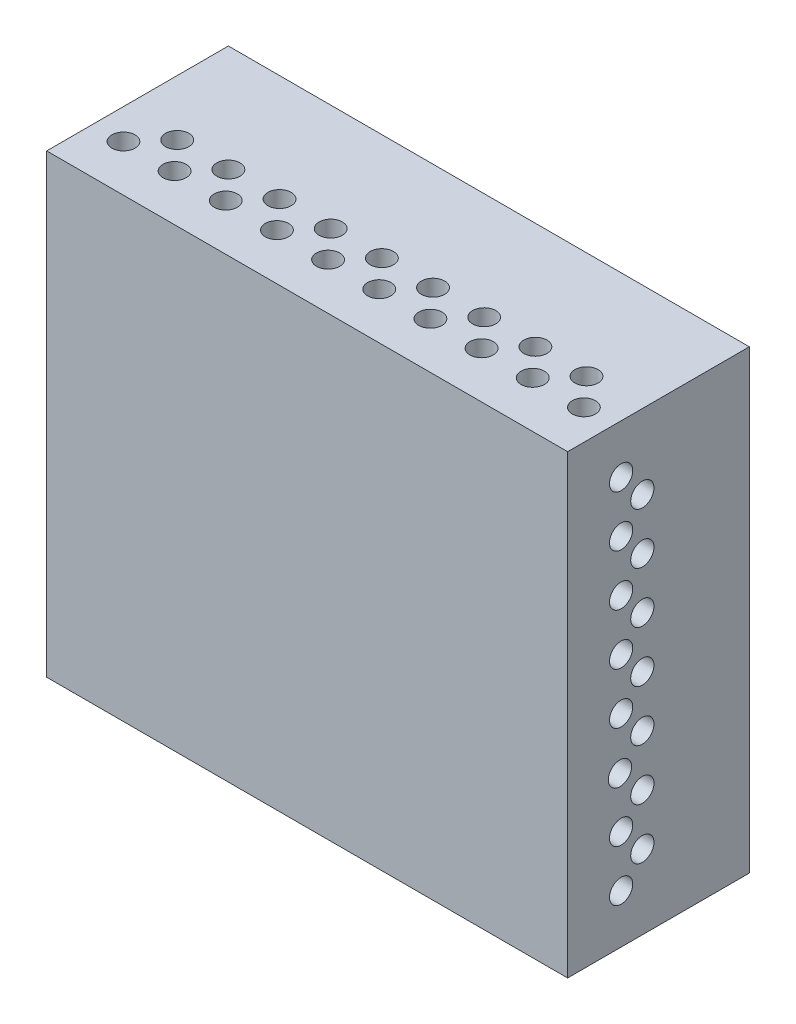
from build123d import *

# Parameters (mm, degrees)
SCHIZZO1_W                    = 56
SCHIZZO1_H                    = 49
ESTRUSIONE_ESTRUSIONE1_DEPTH  = 2
SCHIZZO2_W                    = 2
SCHIZZO2_H                    = 49
ESTRUSIONE_ESTRUSIONE2_DEPTH  = 8.53
SCHIZZO3_W                    = 54
SCHIZZO3_H                    = 2
ESTRUSIONE_ESTRUSIONE3_DEPTH  = 8.53
SCHIZZO4_W                    = 2
SCHIZZO4_H                    = 47
ESTRUSIONE_ESTRUSIONE4_DEPTH  = 8.53
SCHIZZO5_W                    = 52
SCHIZZO5_H                    = 2
ESTRUSIONE_ESTRUSIONE5_DEPTH  = 8.53
SCHIZZO6_W                    = 2
SCHIZZO6_H                    = 41
ESTRUSIONE_ESTRUSIONE6_DEPTH  = 7.5
SCHIZZO7_W                    = 8.581606536
SCHIZZO7_H                    = 4.865819237
TAGLIO_ESTRUSIONE1_DEPTH      = 2
SCHIZZO8_W                    = 2
SCHIZZO8_H                    = 41
ESTRUSIONE_ESTRUSIONE7_DEPTH  = 0.88
SCHIZZO9_W                    = 43
SCHIZZO9_H                    = 2
ESTRUSIONE_ESTRUSIONE8_DEPTH  = 8.38
SCHIZZO10_W                   = 2
SCHIZZO10_H                   = 43
ESTRUSIONE_ESTRUSIONE9_DEPTH  = 8.38
SCHIZZO11_W                   = 7.4
SCHIZZO11_H                   = 35
TAGLIO_ESTRUSIONE2_DEPTH      = 2
SCHIZZO12_W                   = 7.4
SCHIZZO12_H                   = 35
TAGLIO_ESTRUSIONE3_DEPTH      = 2
SCHIZZO14_W                   = 2
SCHIZZO14_H                   = 14.107794906
TAGLIO_ESTRUSIONE5_DEPTH      = 2
SCHIZZO15_W                   = 2
SCHIZZO15_H                   = 2
ESTRUSIONE_ESTRUSIONE10_DEPTH = 7.5
SCHIZZO16_W                   = 4.47
SCHIZZO16_H                   = 4
ESTRUSIONE_ESTRUSIONE11_DEPTH = 6.78
SCHIZZO17_W                   = 5
SCHIZZO17_H                   = 5
ESTRUSIONE_ESTRUSIONE12_DEPTH = 6.78
SCHIZZO18_W                   = 5
SCHIZZO18_H                   = 5
ESTRUSIONE_ESTRUSIONE13_DEPTH = 6.78
SCHIZZO19_W                   = 5
SCHIZZO19_H                   = 5
ESTRUSIONE_ESTRUSIONE14_DEPTH = 6.78
SCHIZZO20_W                   = 31
SCHIZZO20_H                   = 7.4
TAGLIO_ESTRUSIONE6_DEPTH      = 2
SCHIZZO21_W                   = 2
SCHIZZO21_H                   = 1
ESTRUSIONE_ESTRUSIONE15_DEPTH = 7.4
SCHIZZO22_W                   = 2
SCHIZZO22_H                   = 2
ESTRUSIONE_ESTRUSIONE16_DEPTH = 7.4
SCHIZZO23_W                   = 2
SCHIZZO23_H                   = 2
ESTRUSIONE_ESTRUSIONE17_DEPTH = 7.4
SCHIZZO24_W                   = 2
SCHIZZO24_H                   = 2
ESTRUSIONE_ESTRUSIONE18_DEPTH = 7.4
SCHIZZO25_R                   = 1
TAGLIO_ESTRUSIONE7_DEPTH      = 4
SCHIZZO26_W                   = 56
SCHIZZO26_H                   = 1
ESTRUSIONE_ESTRUSIONE19_DEPTH = 9
SCHIZZO27_W                   = 1
SCHIZZO27_H                   = 48
ESTRUSIONE_ESTRUSIONE20_DEPTH = 9
SCHIZZO28_W                   = 55
SCHIZZO28_H                   = 1
ESTRUSIONE_ESTRUSIONE21_DEPTH = 9
SCHIZZO29_W                   = 1
SCHIZZO29_H                   = 47
ESTRUSIONE_ESTRUSIONE22_DEPTH = 9
SCHIZZO30_R                   = 1.25
TAGLIO_ESTRUSIONE8_DEPTH      = 2
SCHIZZO31_R                   = 1.25
TAGLIO_ESTRUSIONE9_DEPTH      = 2
SCHIZZO32_R                   = 1.25
TAGLIO_ESTRUSIONE10_DEPTH     = 2
TAGLIO_ESTRUSIONE11_START     = -2
SCHIZZO33_R                   = 1.25
TAGLIO_ESTRUSIONE11_DEPTH     = 2
SCHIZZO35_R                   = 1.245
SCHIZZO35_R_2                 = 1.25
TAGLIO_ESTRUSIONE12_DEPTH     = 2
SCHIZZO37_R                   = 1.25
TAGLIO_ESTRUSIONE13_DEPTH     = 2
SCHIZZO38_R                   = 1.25
TAGLIO_ESTRUSIONE14_DEPTH     = 2
SCHIZZO39_R                   = 1.25
TAGLIO_ESTRUSIONE15_DEPTH     = 2
SCHIZZO40_R                   = 1.25
TAGLIO_ESTRUSIONE16_DEPTH     = 2
SCHIZZO41_R                   = 1.25
TAGLIO_ESTRUSIONE17_DEPTH     = 2
SCHIZZO42_R                   = 1.25
TAGLIO_ESTRUSIONE18_DEPTH     = 2
SCHIZZO43_W                   = 0.314102565
SCHIZZO43_H                   = 3.5
ESTRUSIONE_ESTRUSIONE23_DEPTH = 1
ESTRUSIONE_ESTRUSIONE24_DEPTH = 1


with BuildPart() as part:
    # Schizzo1 → Estrusione-Estrusione1 (new body)
    with BuildSketch(Plane.XY):
        with Locations((28, 24.5)):
            Rectangle(SCHIZZO1_W, SCHIZZO1_H)
    extrude(amount=ESTRUSIONE_ESTRUSIONE1_DEPTH)

    # Schizzo2 → Estrusione-Estrusione2 (add)
    with BuildSketch(Plane(origin=(0, 0, 0), x_dir=(-1, 0, 0), z_dir=(0, 0, -1))):
        with Locations((-55, 24.5)):
            Rectangle(SCHIZZO2_W, SCHIZZO2_H)
    extrude(amount=ESTRUSIONE_ESTRUSIONE2_DEPTH)

    # Schizzo3 → Estrusione-Estrusione3 (add)
    with BuildSketch(Plane(origin=(0, 0, 0), x_dir=(-1, 0, 0), z_dir=(0, 0, -1))):
        with Locations((-27, 1)):
            Rectangle(SCHIZZO3_W, SCHIZZO3_H)
    extrude(amount=ESTRUSIONE_ESTRUSIONE3_DEPTH)

    # Schizzo4 → Estrusione-Estrusione4 (add)
    with BuildSketch(Plane(origin=(0, 0, 0), x_dir=(-1, 0, 0), z_dir=(0, 0, -1))):
        with Locations((-1, 25.5)):
            Rectangle(SCHIZZO4_W, SCHIZZO4_H)
    extrude(amount=ESTRUSIONE_ESTRUSIONE4_DEPTH)

    # Schizzo5 → Estrusione-Estrusione5 (add)
    with BuildSketch(Plane(origin=(0, 0, 0), x_dir=(-1, 0, 0), z_dir=(0, 0, -1))):
        with Locations((-28, 48)):
            Rectangle(SCHIZZO5_W, SCHIZZO5_H)
    extrude(amount=ESTRUSIONE_ESTRUSIONE5_DEPTH)

    # Schizzo6 → Estrusione-Estrusione6 (add)
    with BuildSketch(Plane(origin=(0, 0, 0), x_dir=(-1, 0, 0), z_dir=(0, 0, -1))):
        with Locations((-49.5, 22.5)):
            Rectangle(SCHIZZO6_W, SCHIZZO6_H)
    extrude(amount=ESTRUSIONE_ESTRUSIONE6_DEPTH)

    # Schizzo7 → Taglio-Estrusione1 (cut)
    with BuildSketch(Plane.XZ):
        with Locations((27.821125734, -4.263608017)):
            Rectangle(SCHIZZO7_W, SCHIZZO7_H)
    extrude(amount=-TAGLIO_ESTRUSIONE1_DEPTH, mode=Mode.SUBTRACT)

    # Schizzo8 → Estrusione-Estrusione7 (add)
    with BuildSketch(Plane(origin=(0, 0, -7.5), x_dir=(-1, 0, 0), z_dir=(0, 0, -1))):
        with Locations((-49.5, 22.5)):
            Rectangle(SCHIZZO8_W, SCHIZZO8_H)
    extrude(amount=ESTRUSIONE_ESTRUSIONE7_DEPTH)

    # Schizzo9 → Estrusione-Estrusione8 (add)
    with BuildSketch(Plane(origin=(0, 0, 0), x_dir=(-1, 0, 0), z_dir=(0, 0, -1))):
        with Locations((-29, 44)):
            Rectangle(SCHIZZO9_W, SCHIZZO9_H)
    extrude(amount=ESTRUSIONE_ESTRUSIONE8_DEPTH)

    # Schizzo10 → Estrusione-Estrusione9 (add)
    with BuildSketch(Plane(origin=(0, 0, 0), x_dir=(-1, 0, 0), z_dir=(0, 0, -1))):
        with Locations((-6.5, 23.5)):
            Rectangle(SCHIZZO10_W, SCHIZZO10_H)
    extrude(amount=ESTRUSIONE_ESTRUSIONE9_DEPTH)

    # Schizzo11 → Taglio-Estrusione2 (cut)
    with BuildSketch(Plane.ZY.offset(-5.5)):
        with Locations((-3.7, 22.5)):
            Rectangle(SCHIZZO11_W, SCHIZZO11_H)
    extrude(amount=-TAGLIO_ESTRUSIONE2_DEPTH, mode=Mode.SUBTRACT)

    # Schizzo12 → Taglio-Estrusione3 (cut)
    with BuildSketch(Plane(origin=(50.5, 0, 0), x_dir=(0, 0, -1), z_dir=(1, 0, 0))):
        with Locations((3.7, 22.5)):
            Rectangle(SCHIZZO12_W, SCHIZZO12_H)
    extrude(amount=-TAGLIO_ESTRUSIONE3_DEPTH, mode=Mode.SUBTRACT)

    # Schizzo14 → Taglio-Estrusione5 (cut)
    with BuildSketch(Plane(origin=(0, 0, -8.38), x_dir=(-1, 0, 0), z_dir=(0, 0, -1))):
        with Locations((-49.5, 25.853897453)):
            Rectangle(SCHIZZO14_W, SCHIZZO14_H)
    extrude(amount=-TAGLIO_ESTRUSIONE5_DEPTH, mode=Mode.SUBTRACT)

    # Schizzo15 → Estrusione-Estrusione10 (add)
    with BuildSketch(Plane.XY.offset(-7.4)):
        with Locations((49.5, 17.8)):
            Rectangle(SCHIZZO15_W, SCHIZZO15_H)
    extrude(amount=ESTRUSIONE_ESTRUSIONE10_DEPTH)

    # Schizzo16 → Estrusione-Estrusione11 (add)
    with BuildSketch(Plane(origin=(0, 0, 0), x_dir=(-1, 0, 0), z_dir=(0, 0, -1))):
        with Locations((-46.265, 4)):
            Rectangle(SCHIZZO16_W, SCHIZZO16_H)
    extrude(amount=ESTRUSIONE_ESTRUSIONE11_DEPTH)

    # Schizzo17 → Estrusione-Estrusione12 (add)
    with BuildSketch(Plane(origin=(0, 0, 0), x_dir=(-1, 0, 0), z_dir=(0, 0, -1))):
        with Locations((-10, 40.5)):
            Rectangle(SCHIZZO17_W, SCHIZZO17_H)
    extrude(amount=ESTRUSIONE_ESTRUSIONE12_DEPTH)

    # Schizzo18 → Estrusione-Estrusione13 (add)
    with BuildSketch(Plane(origin=(0, 0, 0), x_dir=(-1, 0, 0), z_dir=(0, 0, -1))):
        with Locations((-10, 4.5)):
            Rectangle(SCHIZZO18_W, SCHIZZO18_H)
    extrude(amount=ESTRUSIONE_ESTRUSIONE13_DEPTH)

    # Schizzo19 → Estrusione-Estrusione14 (add)
    with BuildSketch(Plane(origin=(0, 0, 0), x_dir=(-1, 0, 0), z_dir=(0, 0, -1))):
        with Locations((-46, 40.5)):
            Rectangle(SCHIZZO19_W, SCHIZZO19_H)
    extrude(amount=ESTRUSIONE_ESTRUSIONE14_DEPTH)

    # Schizzo20 → Taglio-Estrusione6 (cut)
    with BuildSketch(Plane.XZ.offset(-43)):
        with Locations((28, -3.7)):
            Rectangle(SCHIZZO20_W, SCHIZZO20_H)
    extrude(amount=-TAGLIO_ESTRUSIONE6_DEPTH, mode=Mode.SUBTRACT)

    # Schizzo21 → Estrusione-Estrusione15 (add)
    with BuildSketch(Plane(origin=(0, 0, 0), x_dir=(-1, 0, 0), z_dir=(0, 0, -1))):
        with Locations((-49.5, 5.5)):
            Rectangle(SCHIZZO21_W, SCHIZZO21_H)
    extrude(amount=ESTRUSIONE_ESTRUSIONE15_DEPTH)

    # Schizzo22 → Estrusione-Estrusione16 (add)
    with BuildSketch(Plane(origin=(0, 0, 0), x_dir=(-1, 0, 0), z_dir=(0, 0, -1))):
        with Locations((-6.5, 6)):
            Rectangle(SCHIZZO22_W, SCHIZZO22_H)
    extrude(amount=ESTRUSIONE_ESTRUSIONE16_DEPTH)

    # Schizzo23 → Estrusione-Estrusione17 (add)
    with BuildSketch(Plane(origin=(0, 0, 0), x_dir=(-1, 0, 0), z_dir=(0, 0, -1))):
        with Locations((-6.5, 39)):
            Rectangle(SCHIZZO23_W, SCHIZZO23_H)
    extrude(amount=ESTRUSIONE_ESTRUSIONE17_DEPTH)

    # Schizzo24 → Estrusione-Estrusione18 (add)
    with BuildSketch(Plane(origin=(0, 0, 0), x_dir=(-1, 0, 0), z_dir=(0, 0, -1))):
        with Locations((-49.5, 39)):
            Rectangle(SCHIZZO24_W, SCHIZZO24_H)
    extrude(amount=ESTRUSIONE_ESTRUSIONE18_DEPTH)

    # Schizzo25 → Taglio-Estrusione7 (cut)
    with BuildSketch(Plane(origin=(0, 0, -6.78), x_dir=(-1, 0, 0), z_dir=(0, 0, -1))):
        with Locations((-46.2, 4.2)):
            Circle(SCHIZZO25_R)
        with Locations((-10, 40.5)):
            Circle(SCHIZZO25_R)
    extrude(amount=-TAGLIO_ESTRUSIONE7_DEPTH, mode=Mode.SUBTRACT)

    # Schizzo26 → Estrusione-Estrusione19 (add)
    with BuildSketch(Plane(origin=(0, 0, -8.53), x_dir=(-1, 0, 0), z_dir=(0, 0, -1))):
        with Locations((-28, 0.5)):
            Rectangle(SCHIZZO26_W, SCHIZZO26_H)
    extrude(amount=ESTRUSIONE_ESTRUSIONE19_DEPTH)

    # Schizzo27 → Estrusione-Estrusione20 (add)
    with BuildSketch(Plane(origin=(0, 0, -8.53), x_dir=(-1, 0, 0), z_dir=(0, 0, -1))):
        with Locations((-0.5, 25)):
            Rectangle(SCHIZZO27_W, SCHIZZO27_H)
    extrude(amount=ESTRUSIONE_ESTRUSIONE20_DEPTH)

    # Schizzo28 → Estrusione-Estrusione21 (add)
    with BuildSketch(Plane(origin=(0, 0, -8.53), x_dir=(-1, 0, 0), z_dir=(0, 0, -1))):
        with Locations((-28.5, 48.5)):
            Rectangle(SCHIZZO28_W, SCHIZZO28_H)
    extrude(amount=ESTRUSIONE_ESTRUSIONE21_DEPTH)

    # Schizzo29 → Estrusione-Estrusione22 (add)
    with BuildSketch(Plane(origin=(0, 0, -8.53), x_dir=(-1, 0, 0), z_dir=(0, 0, -1))):
        with Locations((-55.5, 24.5)):
            Rectangle(SCHIZZO29_W, SCHIZZO29_H)
    extrude(amount=ESTRUSIONE_ESTRUSIONE22_DEPTH)

    # Schizzo30 → Taglio-Estrusione8 (cut)
    with BuildSketch(Plane.ZY.offset(-54)):
        with Locations((-3.75, 5.25)):
            Circle(SCHIZZO30_R)
        with Locations((-3.75, 10.75)):
            Circle(SCHIZZO30_R)
        with Locations((-3.623443618, 16.25)):
            Circle(SCHIZZO30_R)
        with Locations((-3.75, 21.75)):
            Circle(SCHIZZO30_R)
        with Locations((-3.75, 27.25)):
            Circle(SCHIZZO30_R)
        with Locations((-3.75, 32.75)):
            Circle(SCHIZZO30_R)
        with Locations((-3.75, 38.25)):
            Circle(SCHIZZO30_R)
        with Locations((-3.75, 43.75)):
            Circle(SCHIZZO30_R)
    extrude(amount=-TAGLIO_ESTRUSIONE8_DEPTH, mode=Mode.SUBTRACT)

    # Schizzo31 → Taglio-Estrusione9 (cut)
    with BuildSketch(Plane.ZY.offset(-54)):
        with Locations((-6.03, 41)):
            Circle(SCHIZZO31_R)
        with Locations((-6.03, 35.5)):
            Circle(SCHIZZO31_R)
        with Locations((-6.03, 30)):
            Circle(SCHIZZO31_R)
        with Locations((-6.03, 24.5)):
            Circle(SCHIZZO31_R)
        with Locations((-6.03, 19)):
            Circle(SCHIZZO31_R)
        with Locations((-6.03, 13.5)):
            Circle(SCHIZZO31_R)
        with Locations((-6.03, 8)):
            Circle(SCHIZZO31_R)
    extrude(amount=-TAGLIO_ESTRUSIONE9_DEPTH, mode=Mode.SUBTRACT)

    # Schizzo32 → Taglio-Estrusione10 (cut)
    with BuildSketch(Plane(origin=(2, 0, 0), x_dir=(0, 0, -1), z_dir=(1, 0, 0))):
        with Locations((2.5, 43.75)):
            Circle(SCHIZZO32_R)
        with Locations((2.5, 38.25)):
            Circle(SCHIZZO32_R)
        with Locations((2.5, 32.75)):
            Circle(SCHIZZO32_R)
        with Locations((2.5, 27.25)):
            Circle(SCHIZZO32_R)
        with Locations((2.5, 21.75)):
            Circle(SCHIZZO32_R)
        with Locations((2.5, 16.25)):
            Circle(SCHIZZO32_R)
        with Locations((2.5, 10.75)):
            Circle(SCHIZZO32_R)
        with Locations((2.5, 5.25)):
            Circle(SCHIZZO32_R)
    extrude(amount=-TAGLIO_ESTRUSIONE10_DEPTH, mode=Mode.SUBTRACT)

    # Schizzo33 → Taglio-Estrusione11 (cut)
    with BuildSketch(Plane(origin=(2, 0, 0), x_dir=(0, 0, -1), z_dir=(1, 0, 0)).offset(TAGLIO_ESTRUSIONE11_START)):
        with Locations((6.03, 8)):
            Circle(SCHIZZO33_R)
        with Locations((6.03, 13.5)):
            Circle(SCHIZZO33_R)
        with Locations((6.03, 41)):
            Circle(SCHIZZO33_R)
        with Locations((6.03, 35.5)):
            Circle(SCHIZZO33_R)
        with Locations((6.03, 30)):
            Circle(SCHIZZO33_R)
        with Locations((6.03, 24.5)):
            Circle(SCHIZZO33_R)
        with Locations((6.03, 19)):
            Circle(SCHIZZO33_R)
    extrude(amount=TAGLIO_ESTRUSIONE11_DEPTH, mode=Mode.SUBTRACT)

    # Schizzo35 → Taglio-Estrusione12 (cut)
    with BuildSketch(Plane(origin=(0, 47, 0), x_dir=(-1, 0, 0), z_dir=(0, -1, 0))):
        with Locations((-3.25, 3)):
            Circle(SCHIZZO35_R)
        with Locations((-8.75, 3)):
            Circle(SCHIZZO35_R_2)
        with Locations((-14.25, 3)):
            Circle(SCHIZZO35_R_2)
        with Locations((-19.75, 3)):
            Circle(SCHIZZO35_R_2)
        with Locations((-25.25, 3)):
            Circle(SCHIZZO35_R_2)
        with Locations((-30.75, 3)):
            Circle(SCHIZZO35_R_2)
        with Locations((-36.25, 3)):
            Circle(SCHIZZO35_R_2)
        with Locations((-41.75, 3)):
            Circle(SCHIZZO35_R_2)
        with Locations((-47.25, 3)):
            Circle(SCHIZZO35_R_2)
        with Locations((-52.75, 3)):
            Circle(SCHIZZO35_R)
    extrude(amount=-TAGLIO_ESTRUSIONE12_DEPTH, mode=Mode.SUBTRACT)

    # Schizzo37 → Taglio-Estrusione13 (cut)
    with BuildSketch(Plane(origin=(0, 47, 0), x_dir=(-1, 0, 0), z_dir=(0, -1, 0))):
        with Locations((-50, 6.03)):
            Circle(SCHIZZO37_R)
        with Locations((-44.5, 6.03)):
            Circle(SCHIZZO37_R)
        with Locations((-39, 6.03)):
            Circle(SCHIZZO37_R)
        with Locations((-33.5, 6.03)):
            Circle(SCHIZZO37_R)
        with Locations((-28, 6.03)):
            Circle(SCHIZZO37_R)
        with Locations((-22.5, 6.03)):
            Circle(SCHIZZO37_R)
        with Locations((-17, 6.03)):
            Circle(SCHIZZO37_R)
        with Locations((-11.5, 6.03)):
            Circle(SCHIZZO37_R)
        with Locations((-6, 6.03)):
            Circle(SCHIZZO37_R)
    extrude(amount=-TAGLIO_ESTRUSIONE13_DEPTH, mode=Mode.SUBTRACT)

    # Schizzo38 → Taglio-Estrusione14 (cut)
    with BuildSketch(Plane(origin=(0, 2, 0), x_dir=(1, 0, 0), z_dir=(0, 1, 0))):
        with Locations((52.25, 3.75)):
            Circle(SCHIZZO38_R)
        with Locations((3.75, 3.75)):
            Circle(SCHIZZO38_R)
    extrude(amount=-TAGLIO_ESTRUSIONE14_DEPTH, mode=Mode.SUBTRACT)

    # Schizzo39 → Taglio-Estrusione15 (cut)
    with BuildSketch(Plane(origin=(0, 2, 0), x_dir=(1, 0, 0), z_dir=(0, 1, 0))):
        with Locations((41.28, 3.75)):
            Circle(SCHIZZO39_R)
        with Locations((35.78, 3.75)):
            Circle(SCHIZZO39_R)
    extrude(amount=-TAGLIO_ESTRUSIONE15_DEPTH, mode=Mode.SUBTRACT)

    # Schizzo40 → Taglio-Estrusione16 (cut)
    with BuildSketch(Plane(origin=(0, 2, 0), x_dir=(1, 0, 0), z_dir=(0, 1, 0))):
        with Locations((15.25, 3.75)):
            Circle(SCHIZZO40_R)
        with Locations((20.75, 3.75)):
            Circle(SCHIZZO40_R)
    extrude(amount=-TAGLIO_ESTRUSIONE16_DEPTH, mode=Mode.SUBTRACT)

    # Schizzo41 → Taglio-Estrusione17 (cut)
    with BuildSketch(Plane(origin=(0, 2, 0), x_dir=(1, 0, 0), z_dir=(0, 1, 0))):
        with Locations((38.53, 5.38)):
            Circle(SCHIZZO41_R)
    extrude(amount=-TAGLIO_ESTRUSIONE17_DEPTH, mode=Mode.SUBTRACT)

    # Schizzo42 → Taglio-Estrusione18 (cut)
    with BuildSketch(Plane(origin=(0, 2, 0), x_dir=(1, 0, 0), z_dir=(0, 1, 0))):
        with Locations((18, 5.38)):
            Circle(SCHIZZO42_R)
    extrude(amount=-TAGLIO_ESTRUSIONE18_DEPTH, mode=Mode.SUBTRACT)

    # Schizzo43 → Estrusione-Estrusione23 (add)
    with BuildSketch(Plane(origin=(0, 0, 0), x_dir=(-1, 0, 0), z_dir=(0, -1, 0))):
        with Locations((-30.427109959, 9.9053361)):
            Rectangle(SCHIZZO43_W, SCHIZZO43_H)
    extrude(amount=ESTRUSIONE_ESTRUSIONE23_DEPTH)

    # Schizzo44 → Estrusione-Estrusione24 (add)
    with BuildSketch(Plane(origin=(0, 0, 0), x_dir=(-1, 0, 0), z_dir=(0, -1, 0))):
        with BuildLine():
            add(Edge.make_bspline(
                [(-26.515508599, 9.876347198), (-26.515180581, 9.932444586), (-26.514543401, 10.04141457), (-26.50745498, 10.200199212), (-26.495679638, 10.349159501), (-26.479542265, 10.488302567), (-26.459904285, 10.617664332), (-26.433688798, 10.736899089), (-26.403875996, 10.846558696), (-26.36932355, 10.947000744), (-26.330335761, 11.039578447), (-26.2879015, 11.126003648), (-26.240336706, 11.206145581), (-26.190359793, 11.281283371), (-26.135947721, 11.350187066), (-26.078648931, 11.413829728), (-26.016227054, 11.470740479), (-25.950804046, 11.522586781), (-25.881787582, 11.568036253), (-25.811144916, 11.608068991), (-25.73838981, 11.642268859), (-25.663323627, 11.669159295), (-25.586621069, 11.691370141), (-25.508014002, 11.706559089), (-25.427372638, 11.716115998), (-25.372941203, 11.717029665), (-25.345336324, 11.717493031)],
                knots=[0, 0, 0, 0, 1.646270934, 3.197905019, 4.663502075, 6.030701355, 7.308322542, 8.50163776, 9.611534131, 10.641858119, 11.616356847, 12.558055219, 13.465016945, 14.349605745, 15.204443733, 16.039544428, 16.859896111, 17.680448484, 18.487036065, 19.28249412, 20.06191084, 20.843045899, 21.620316918, 22.403196591, 23.190181807, 24, 24, 24, 24], degree=3))
            add(Edge.make_bspline(
                [(-25.345336324, 11.717493031), (-25.317500845, 11.717005216), (-25.262144836, 11.716035105), (-25.180304461, 11.706711163), (-25.100354779, 11.69124004), (-25.022636641, 11.669319065), (-24.946511654, 11.642123389), (-24.872575247, 11.608036271), (-24.800368165, 11.568357404), (-24.731037877, 11.521733527), (-24.663823262, 11.469751251), (-24.600375299, 11.410988582), (-24.540688213, 11.346038863), (-24.484012908, 11.275596999), (-24.431957311, 11.198311914), (-24.382383878, 11.115527804), (-24.338011842, 11.025796939), (-24.295277167, 10.930616471), (-24.258390181, 10.827352813), (-24.225123935, 10.716588052), (-24.198244967, 10.597013865), (-24.175855694, 10.46925762), (-24.158510798, 10.332850137), (-24.145878156, 10.188083821), (-24.139205071, 10.03486343), (-24.13794837, 9.930105581), (-24.137303471, 9.876347198)],
                knots=[0, 0, 0, 0, 0.810914788, 1.612654377, 2.396697861, 3.181598691, 3.963628158, 4.749916497, 5.551656086, 6.361998678, 7.18212741, 8.025565596, 8.878627764, 9.750805457, 10.657531673, 11.591944965, 12.560506719, 13.57287815, 14.630710178, 15.753379473, 16.941251878, 18.199788006, 19.531962791, 20.947069417, 22.433333509, 24, 24, 24, 24], degree=3))
            add(Edge.make_bspline(
                [(-24.137303471, 9.876347198), (-24.137955056, 9.82282329), (-24.139224642, 9.718534138), (-24.145803348, 9.566003163), (-24.15876198, 9.42200512), (-24.174971968, 9.286194657), (-24.197422931, 9.159137038), (-24.225028097, 9.04039259), (-24.25567842, 8.929448518), (-24.293513214, 8.827213707), (-24.334923924, 8.732261984), (-24.379979121, 8.643594836), (-24.428248947, 8.560428543), (-24.480837692, 8.483428796), (-24.536891105, 8.412050139), (-24.597608894, 8.347552516), (-24.661279479, 8.288381844), (-24.728691895, 8.235730217), (-24.799103446, 8.189645412), (-24.871062523, 8.148431562), (-24.945845906, 8.115198867), (-25.021758859, 8.086663826), (-25.099887225, 8.064863374), (-25.180133616, 8.049789518), (-25.262089851, 8.03921767), (-25.317491417, 8.03841119), (-25.345336324, 8.038005852)],
                knots=[0, 0, 0, 0, 1.561518951, 3.042555995, 4.452378317, 5.7783523, 7.031515105, 8.214008947, 9.334062868, 10.386615937, 11.391082383, 12.354592575, 13.286541444, 14.194233754, 15.072674879, 15.931287219, 16.775624067, 17.606195743, 18.42308326, 19.229000347, 20.022332153, 20.807536673, 21.593273796, 22.3848459, 23.188221202, 24, 24, 24, 24], degree=3))
            add(Edge.make_bspline(
                [(-25.345336324, 8.038005852), (-25.372940438, 8.038472207), (-25.427370362, 8.039391769), (-25.508022788, 8.048905501), (-25.586305231, 8.064201004), (-25.662603985, 8.085617608), (-25.7373105, 8.111832445), (-25.809406787, 8.145986128), (-25.879694471, 8.185320197), (-25.947986027, 8.230115618), (-26.012998188, 8.281437302), (-26.075096793, 8.33820159), (-26.132721812, 8.401825002), (-26.186355908, 8.471302925), (-26.237329996, 8.545996167), (-26.284219369, 8.62692454), (-26.327590223, 8.713767151), (-26.367233714, 8.807085061), (-26.402382378, 8.908239989), (-26.433430086, 9.018389168), (-26.457944243, 9.138504804), (-26.478927199, 9.267622171), (-26.495851582, 9.406296101), (-26.507405907, 9.554601879), (-26.514547222, 9.712447088), (-26.515182292, 9.820716863), (-26.515508599, 9.876347198)],
                knots=[0, 0, 0, 0, 0.810891512, 1.598919785, 2.382837074, 3.152667961, 3.926044502, 4.706494248, 5.493654104, 6.291793342, 7.103789334, 7.925228297, 8.761435821, 9.622817696, 10.50288917, 11.416980706, 12.369136599, 13.353924996, 14.394355917, 15.514179734, 16.714354668, 17.994756427, 19.357759367, 20.818452758, 22.365282078, 24, 24, 24, 24], degree=3))
        make_face()
        with BuildLine():
            add(Edge.make_bspline(
                [(-26.201406035, 9.877749442), (-26.201286588, 9.831000743), (-26.201054765, 9.740270698), (-26.194998564, 9.608427437), (-26.186748332, 9.485457108), (-26.176107035, 9.371203572), (-26.160304087, 9.266053559), (-26.142597299, 9.169283876), (-26.121049209, 9.081406639), (-26.095554191, 9.001818828), (-26.066515094, 8.92916976), (-26.034809231, 8.861568545), (-26.000748508, 8.798216608), (-25.962629357, 8.739683), (-25.921114294, 8.685776836), (-25.877141035, 8.635544004), (-25.829068451, 8.590747022), (-25.762564708, 8.537020167), (-25.674768234, 8.481501034), (-25.564147778, 8.433154944), (-25.450479327, 8.402772487), (-25.373328077, 8.398908731), (-25.334819497, 8.396980211)],
                knots=[0, 0, 0, 0, 1.459021318, 2.831673884, 4.118529203, 5.306027144, 6.411944654, 7.436330062, 8.375795394, 9.233974572, 10.042671642, 10.816086306, 11.563610507, 12.285937304, 12.993564865, 13.685989202, 14.367179055, 15.041617293, 16.353048772, 17.594441528, 18.799311195, 20, 20, 20, 20], degree=3))
            add(Edge.make_bspline(
                [(-25.334819497, 8.396980211), (-25.296061825, 8.398577992), (-25.218626502, 8.401770255), (-25.105492707, 8.432568992), (-24.995662437, 8.479038531), (-24.909590496, 8.533986037), (-24.844107953, 8.586314366), (-24.797190963, 8.630929015), (-24.754128914, 8.680884882), (-24.71328684, 8.734784178), (-24.675827764, 8.793656662), (-24.641764626, 8.857219237), (-24.610681279, 8.925648415), (-24.592972233, 8.973418154), (-24.583918054, 8.997841589)],
                knots=[0, 0, 0, 0, 1.353760809, 2.704726607, 4.075137775, 5.516104923, 6.260822281, 7.007110065, 7.778089737, 8.566572457, 9.372053459, 10.217411131, 11.088608312, 12, 12, 12, 12], degree=3))
            add(Edge.make_bspline(
                [(-24.583918054, 8.997841589), (-24.573366287, 9.029071329), (-24.551941673, 9.092481093), (-24.524329899, 9.190844745), (-24.502584499, 9.294047509), (-24.483021134, 9.401472626), (-24.469668078, 9.513912327), (-24.458920264, 9.631018711), (-24.452589577, 9.752880073), (-24.451804826, 9.835675064), (-24.451406035, 9.877749442)],
                knots=[0, 0, 0, 0, 0.884706709, 1.796334032, 2.740027952, 3.714592787, 4.726048262, 5.777819803, 6.87074269, 8, 8, 8, 8], degree=3))
            add(Edge.make_bspline(
                [(-24.451406035, 9.877749442), (-24.451956224, 9.919817014), (-24.453032512, 10.002110179), (-24.4571465, 10.12262836), (-24.467770074, 10.237096121), (-24.479569193, 10.346006593), (-24.496966414, 10.448756896), (-24.515724221, 10.546207201), (-24.540925434, 10.637150226), (-24.567845209, 10.723009808), (-24.598655604, 10.802810462), (-24.632571338, 10.876924249), (-24.668793097, 10.945708973), (-24.708135338, 11.008975915), (-24.750131021, 11.067008458), (-24.79588857, 11.118643052), (-24.843592943, 11.165480021), (-24.910410128, 11.21894259), (-24.997884418, 11.273454285), (-25.106730066, 11.323620045), (-25.22000071, 11.352428338), (-25.296574164, 11.356490025), (-25.334819497, 11.358518673)],
                knots=[0, 0, 0, 0, 1.31362396, 2.569729283, 3.763502607, 4.902122613, 5.988968491, 7.01645872, 7.998833611, 8.933434873, 9.825090667, 10.667526885, 11.477055099, 12.250526234, 12.991942729, 13.710640831, 14.402115721, 15.076753259, 16.378508321, 17.609869233, 18.806226677, 20, 20, 20, 20], degree=3))
            add(Edge.make_bspline(
                [(-25.334819497, 11.358518673), (-25.373530089, 11.356487226), (-25.451021794, 11.352420632), (-25.565469749, 11.323727378), (-25.675174101, 11.273714412), (-25.762417076, 11.21876204), (-25.829280862, 11.166423728), (-25.876363555, 11.121037274), (-25.920509728, 11.07139102), (-25.961177428, 11.016989105), (-25.999266711, 10.958523738), (-26.034247724, 10.895534973), (-26.065765053, 10.827703609), (-26.094849589, 10.755087173), (-26.120422377, 10.675506229), (-26.141516341, 10.587737235), (-26.161003394, 10.491275344), (-26.174798663, 10.385555836), (-26.187062418, 10.271273682), (-26.194943766, 10.147996364), (-26.201075024, 10.015931984), (-26.201293488, 9.924732825), (-26.201406035, 9.877749442)],
                knots=[0, 0, 0, 0, 1.207732386, 2.417664972, 3.655092373, 4.956220595, 5.625982001, 6.301752483, 6.994047911, 7.697131622, 8.419323945, 9.170223765, 9.943494443, 10.752040957, 11.610060368, 12.549350801, 13.567764191, 14.679664412, 15.874934091, 17.154273443, 18.533957287, 20, 20, 20, 20], degree=3))
        make_face(mode=Mode.SUBTRACT)
    extrude(amount=ESTRUSIONE_ESTRUSIONE24_DEPTH)


solid = part.part
